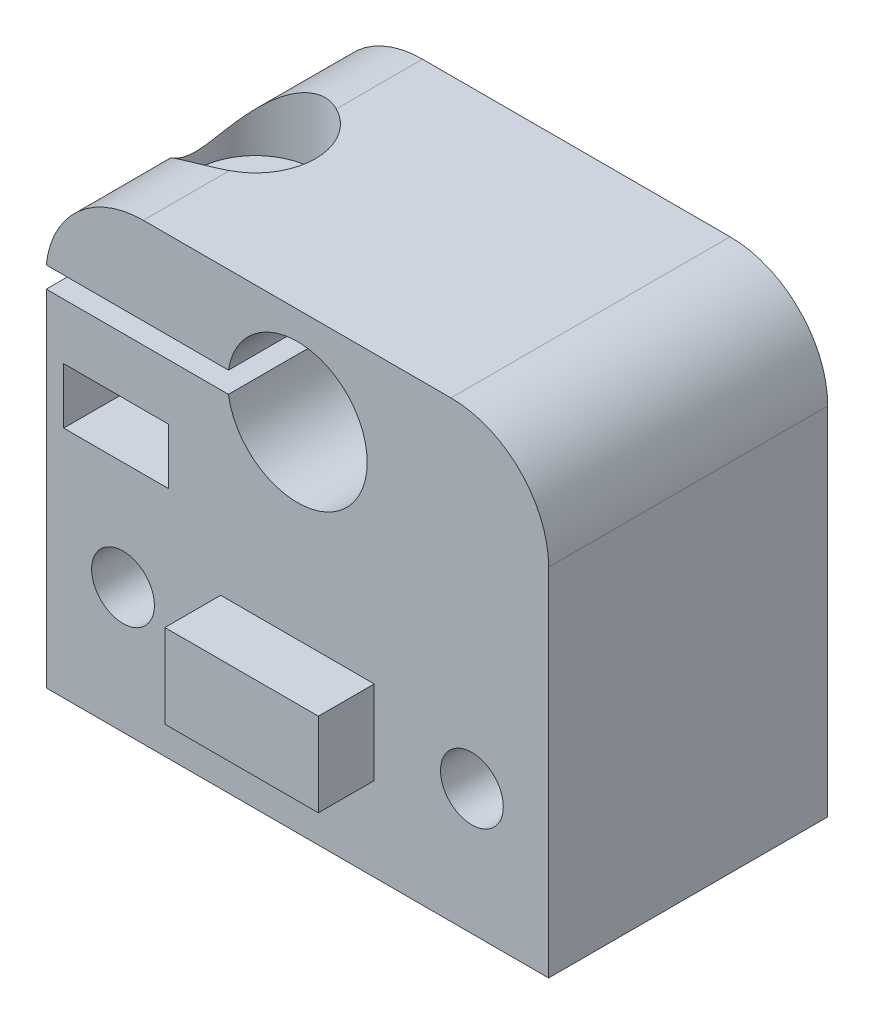
from build123d import *

# Parameters (mm, degrees)
SKETCH_1_W           = 36
SKETCH_1_H           = 20
EXTRUDE_1_DEPTH      = 32.5
SKETCH_4_R           = 5
CUT_EXTRUDE_2_DEPTH  = 47
SKETCH_9_R           = 2.25
CUT_EXTRUDE_7_DEPTH  = 27
SKETCH_10_W          = 11
SKETCH_10_H          = 6
EXTRUDE_2_DEPTH      = 4
SKETCH_11_R          = 2.25
CUT_EXTRUDE_8_DEPTH  = 20
SKETCH_12_R          = 4.3
CUT_EXTRUDE_9_DEPTH  = 5
SKETCH_13_W          = 7.5
SKETCH_13_H          = 4
CUT_EXTRUDE_10_DEPTH = 22
SKETCH_14_R          = 4.3
CUT_EXTRUDE_11_DEPTH = 7
FILLET_1_R           = 7


with BuildPart() as part:
    # Эскиз1 → Бобышка-Вытянуть1 (new body)
    with BuildSketch(Plane(origin=(0, 0, 0), x_dir=(1, 0, 0), z_dir=(0, 1, 0))):
        with Locations((18, 10)):
            Rectangle(SKETCH_1_W, SKETCH_1_H)
    extrude(amount=EXTRUDE_1_DEPTH)

    # Эскиз4 → Вырез-Вытянуть2 (cut)
    with BuildSketch(Plane.XY):
        with Locations((18, 25.5)):
            Circle(SKETCH_4_R)
        with BuildLine():
            ThreePointArc((13.056570017, 24.75), (13, 25.5), (13.056570017, 26.25))
            Line((13.056570017, 26.25), (0, 26.25))
            Line((0, 26.25), (0, 24.75))
            Line((0, 24.75), (13.056570017, 24.75))
        make_face()
    extrude(amount=-CUT_EXTRUDE_2_DEPTH, mode=Mode.SUBTRACT)

    # Эскиз9 → Вырез-Вытянуть7 (cut)
    with BuildSketch(Plane.XY):
        with Locations((30.5, 9)):
            Circle(SKETCH_9_R)
        with Locations((5.5, 9)):
            Circle(SKETCH_9_R)
    extrude(amount=-CUT_EXTRUDE_7_DEPTH, mode=Mode.SUBTRACT)

    # Эскиз10 → Бобышка-Вытянуть2 (add)
    with BuildSketch(Plane.XY):
        with Locations((18, 9)):
            Rectangle(SKETCH_10_W, SKETCH_10_H)
    extrude(amount=EXTRUDE_2_DEPTH)

    # Эскиз11 → Вырез-Вытянуть8 (cut)
    with BuildSketch(Plane(origin=(0, 32.5, 0), x_dir=(1, 0, 0), z_dir=(0, 1, 0))):
        with Locations(Location((5, 10, 0), (0, 0, 270))):
            Circle(SKETCH_11_R)
    extrude(amount=-CUT_EXTRUDE_8_DEPTH, mode=Mode.SUBTRACT)

    # Эскиз12 → Вырез-Вытянуть9 (cut)
    with BuildSketch(Plane(origin=(0, 32.5, 0), x_dir=(1, 0, 0), z_dir=(0, 1, 0))):
        with Locations(Location((5, 10, 0), (0, 0, 270))):
            Circle(SKETCH_12_R)
    extrude(amount=-CUT_EXTRUDE_9_DEPTH, mode=Mode.SUBTRACT)

    # Эскиз13 → Вырез-Вытянуть10 (cut)
    with BuildSketch(Plane(origin=(0, 0, -20), x_dir=(-1, 0, 0), z_dir=(0, 0, -1))):
        with Locations((-5, 18.75)):
            Rectangle(SKETCH_13_W, SKETCH_13_H)
    extrude(amount=-CUT_EXTRUDE_10_DEPTH, mode=Mode.SUBTRACT)

    # Эскиз14 → Вырез-Вытянуть11 (cut)
    with BuildSketch(Plane(origin=(0, 0, -20), x_dir=(-1, 0, 0), z_dir=(0, 0, -1))):
        with Locations((-30.5, 9)):
            Circle(SKETCH_14_R)
        with Locations((-5.5, 9)):
            Circle(SKETCH_14_R)
    extrude(amount=-CUT_EXTRUDE_11_DEPTH, mode=Mode.SUBTRACT)

    # Скругление1
    # the kernel refuses this fillet: 7 mm, written as the material it takes off along each edge
    with BuildSketch(Plane(origin=(36, 32.5, 17.5), x_dir=(0, -1, 0), z_dir=(0, 0, -1))) as fillet_1_piece_1:
        with BuildLine():
            CenterArc((FILLET_1_R, FILLET_1_R), FILLET_1_R, 180, 90)
            Line((0, FILLET_1_R), (0, 0))
            Line((0, 0), (FILLET_1_R, 0))
        make_face()
    extrude(amount=55, mode=Mode.SUBTRACT)
    with BuildSketch(Plane(origin=(0, 32.5, -37.399263634), x_dir=(1, 0, 0), z_dir=(0, 0, 1))) as fillet_1_piece_2:
        with BuildLine():
            CenterArc((6.959705454, -7), FILLET_1_R, 90, 83.849360172)
            Line((0, -6.25), (0, 0))
            Line((0, 0), (6.959705454, 0))
        make_face()
    extrude(amount=54.798527268, mode=Mode.SUBTRACT)


solid = part.part
